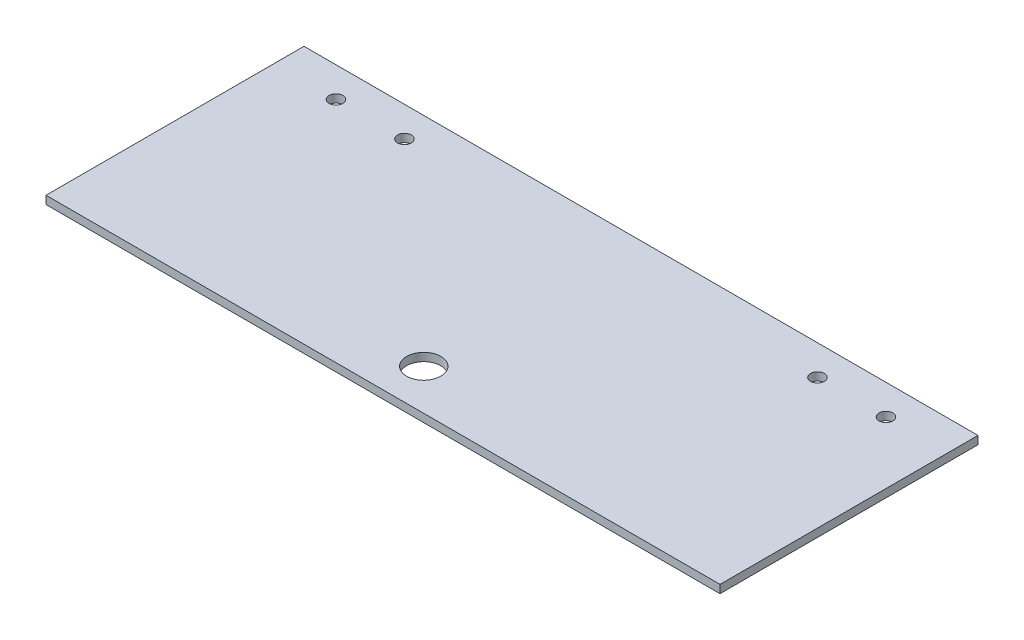
from build123d import *

# Parameters (mm, degrees)
SKETCH1_W           = 250
SKETCH1_H           = 95.7
SKETCH1_R           = 2.564
SKETCH1_R_2         = 6.35
BOSS_EXTRUDE1_DEPTH = 3


with BuildPart() as part:
    # Sketch1 → Boss-Extrude1 (new body)
    with BuildSketch(Plane(origin=(0, 0, 0), x_dir=(1, 0, 0), z_dir=(0, 1, 0))):
        with Locations((125, 47.85)):
            Rectangle(SKETCH1_W, SKETCH1_H)
        with Locations((23, 84.56)):
            Circle(SKETCH1_R, mode=Mode.SUBTRACT)
        with Locations((48.4, 84.56)):
            Circle(SKETCH1_R, mode=Mode.SUBTRACT)
        with Locations((201.6, 84.56)):
            Circle(SKETCH1_R, mode=Mode.SUBTRACT)
        with Locations((227, 84.56)):
            Circle(SKETCH1_R, mode=Mode.SUBTRACT)
        with Locations((125, 15.1)):
            Circle(SKETCH1_R_2, mode=Mode.SUBTRACT)
    extrude(amount=BOSS_EXTRUDE1_DEPTH)


solid = part.part
